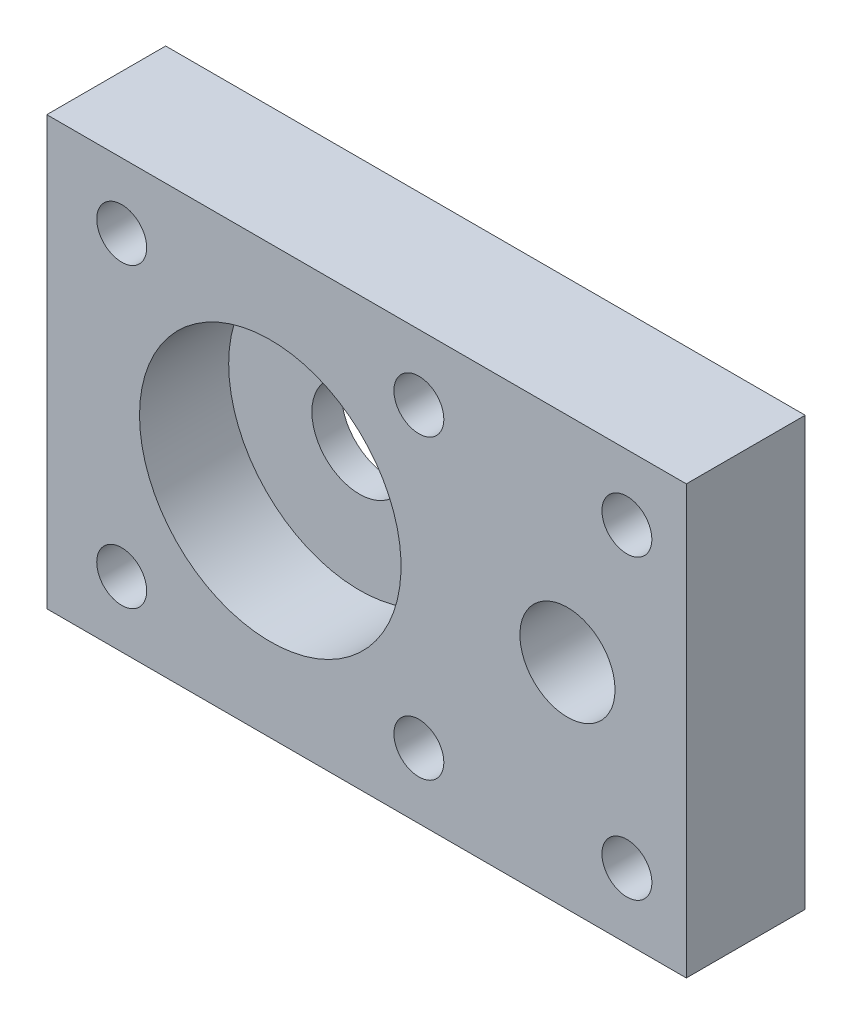
from build123d import *

# Parameters (mm, degrees)
JOTYY_MIRRORED_START         = -10
JOTYY_MIRRORED_OUTLINE_W     = 53.8
JOTYY_MIRRORED_OUTLINE_H     = 36
JOTYY_MIRRORED_OUTLINE_R     = 2.1
JOTYY_MIRRORED_OUTLINE_R_2   = 11
JOTYY_MIRRORED_DEPTH         = 10
JOTYY_MIRRORED_2_OUTLINE_R   = 11
JOTYY_MIRRORED_2_OUTLINE_R_2 = 4
JOTYY_MIRRORED_2_DEPTH       = 2.5
SKETCH1_R                    = 4
CUT_EXTRUDE1_DEPTH           = 10


# Read off the part's stored shape, not the designer's step: jotyy_Mirrored
with BuildPart() as part:
    # jotyy_Mirrored outline → jotyy_Mirrored (new body)
    with BuildSketch(Plane.XY.offset(JOTYY_MIRRORED_START)):
        with Locations((-26.9, 20)):
            Rectangle(JOTYY_MIRRORED_OUTLINE_W, JOTYY_MIRRORED_OUTLINE_H)
        with Locations((-47.5, 7.5)):
            Circle(JOTYY_MIRRORED_OUTLINE_R, mode=Mode.SUBTRACT)
        with Locations((-22.5, 7.5)):
            Circle(JOTYY_MIRRORED_OUTLINE_R, mode=Mode.SUBTRACT)
        with Locations((-5, 7.5)):
            Circle(JOTYY_MIRRORED_OUTLINE_R, mode=Mode.SUBTRACT)
        with Locations((-35, 20)):
            Circle(JOTYY_MIRRORED_OUTLINE_R_2, mode=Mode.SUBTRACT)
        with Locations((-47.5, 32.5)):
            Circle(JOTYY_MIRRORED_OUTLINE_R, mode=Mode.SUBTRACT)
        with Locations((-22.5, 32.5)):
            Circle(JOTYY_MIRRORED_OUTLINE_R, mode=Mode.SUBTRACT)
        with Locations((-5, 32.5)):
            Circle(JOTYY_MIRRORED_OUTLINE_R, mode=Mode.SUBTRACT)
    extrude(amount=JOTYY_MIRRORED_DEPTH)

    # jotyy_Mirrored 2 outline → jotyy_Mirrored 2 (add)
    with BuildSketch(Plane.XY.offset(JOTYY_MIRRORED_START)):
        with Locations((-35, 20)):
            Circle(JOTYY_MIRRORED_2_OUTLINE_R)
        with Locations((-35, 20)):
            Circle(JOTYY_MIRRORED_2_OUTLINE_R_2, mode=Mode.SUBTRACT)
    extrude(amount=JOTYY_MIRRORED_2_DEPTH)

    # Sketch1 → Cut-Extrude1 (cut)
    with BuildSketch(Plane.XY):
        with Locations((-10, 20)):
            Circle(SKETCH1_R)
    extrude(amount=-CUT_EXTRUDE1_DEPTH, mode=Mode.SUBTRACT)


solid = part.part
